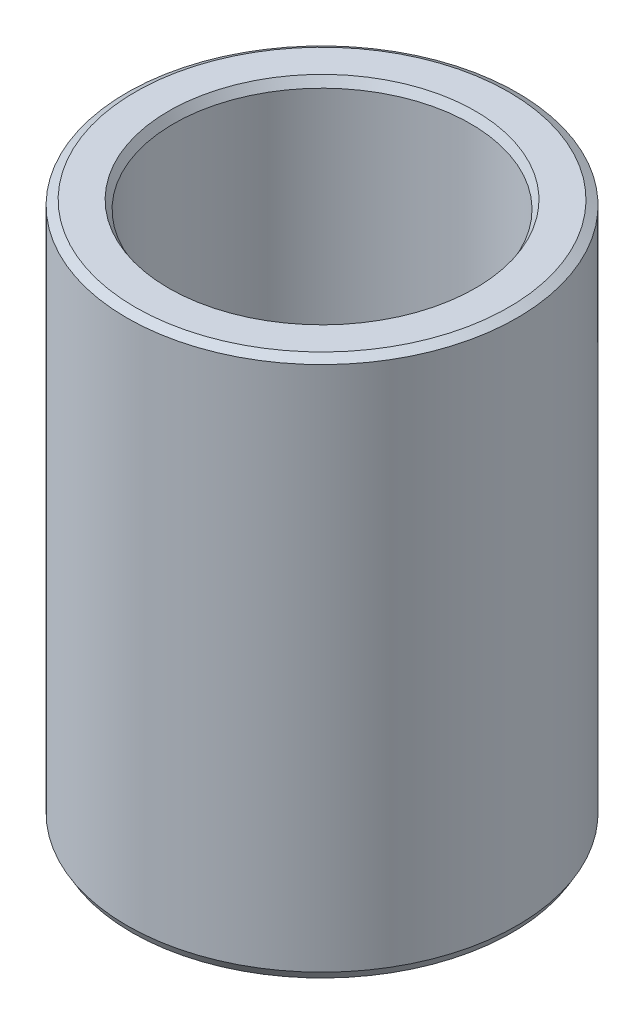
from build123d import *
from OCP.BRepFilletAPI import BRepFilletAPI_MakeChamfer

# Parameters (mm, degrees)
SKETCH1_R           = 45
BOSS_EXTRUDE1_DEPTH = 124.429205217
SKETCH2_R           = 34.242768979
CUT_EXTRUDE1_DEPTH  = 140.759175409
CHAMFER1_SIZE       = 1.1323149
CHAMFER1_SIZE2      = 1.961226936


with BuildPart() as part:
    # Sketch1 → Boss-Extrude1 (new body)
    with BuildSketch(Plane(origin=(0, 0, 0), x_dir=(1, 0, 0), z_dir=(0, 1, 0))):
        Circle(SKETCH1_R)
    extrude(amount=BOSS_EXTRUDE1_DEPTH)

    # Sketch2 → Cut-Extrude1 (cut, through all)
    with BuildSketch(Plane(origin=(0, 0, 0), x_dir=(1, 0, 0), z_dir=(0, 1, 0))):
        Circle(SKETCH2_R)
    extrude(amount=CUT_EXTRUDE1_DEPTH, mode=Mode.SUBTRACT)

    # Chamfer1: one chamfer whose edges measure the first distance from different faces: ONE call of the kernel's chamfer builder (chamfer() names one face for all edges)
    chamfer1_edges_1 = [part.edges().sort_by_distance(p)[0] for p in [
        (-34.242768979, 124.429205217, 0),
    ]]
    chamfer1_side_1 = [part.faces().sort_by_distance(p)[0] for p in [
        (-43.727207794, 124.429205217, 0),
    ]]
    chamfer1_edges_2 = [part.edges().sort_by_distance(p)[0] for p in [
        (-34.242768979, 0, 0),
    ]]
    chamfer1_side_2 = [part.faces().sort_by_distance(p)[0] for p in [
        (-34.242768979, 62.214602609, 0),
    ]]
    chamfer1_edges_3 = [part.edges().sort_by_distance(p)[0] for p in [
        (-45, 0, 0),
    ]]
    chamfer1_side_3 = [part.faces().sort_by_distance(p)[0] for p in [
        (-43.727207794, 0, 0),
    ]]
    chamfer1_edges_4 = [part.edges().sort_by_distance(p)[0] for p in [
        (-45, 124.429205217, 0),
    ]]
    chamfer1_side_4 = [part.faces().sort_by_distance(p)[0] for p in [
        (-45, 62.214602609, 0),
    ]]
    chamfer1 = BRepFilletAPI_MakeChamfer(part.part.solid().wrapped)
    for e in chamfer1_edges_1:
        chamfer1.Add(CHAMFER1_SIZE, CHAMFER1_SIZE2, e.wrapped, chamfer1_side_1[0].wrapped)  # the first distance lies on this face
    for e in chamfer1_edges_2:
        chamfer1.Add(CHAMFER1_SIZE, CHAMFER1_SIZE2, e.wrapped, chamfer1_side_2[0].wrapped)  # the first distance lies on this face
    for e in chamfer1_edges_3:
        chamfer1.Add(CHAMFER1_SIZE, CHAMFER1_SIZE2, e.wrapped, chamfer1_side_3[0].wrapped)  # the first distance lies on this face
    for e in chamfer1_edges_4:
        chamfer1.Add(CHAMFER1_SIZE, CHAMFER1_SIZE2, e.wrapped, chamfer1_side_4[0].wrapped)  # the first distance lies on this face
    add(Compound.cast(chamfer1.Shape()), mode=Mode.REPLACE)


solid = part.part
